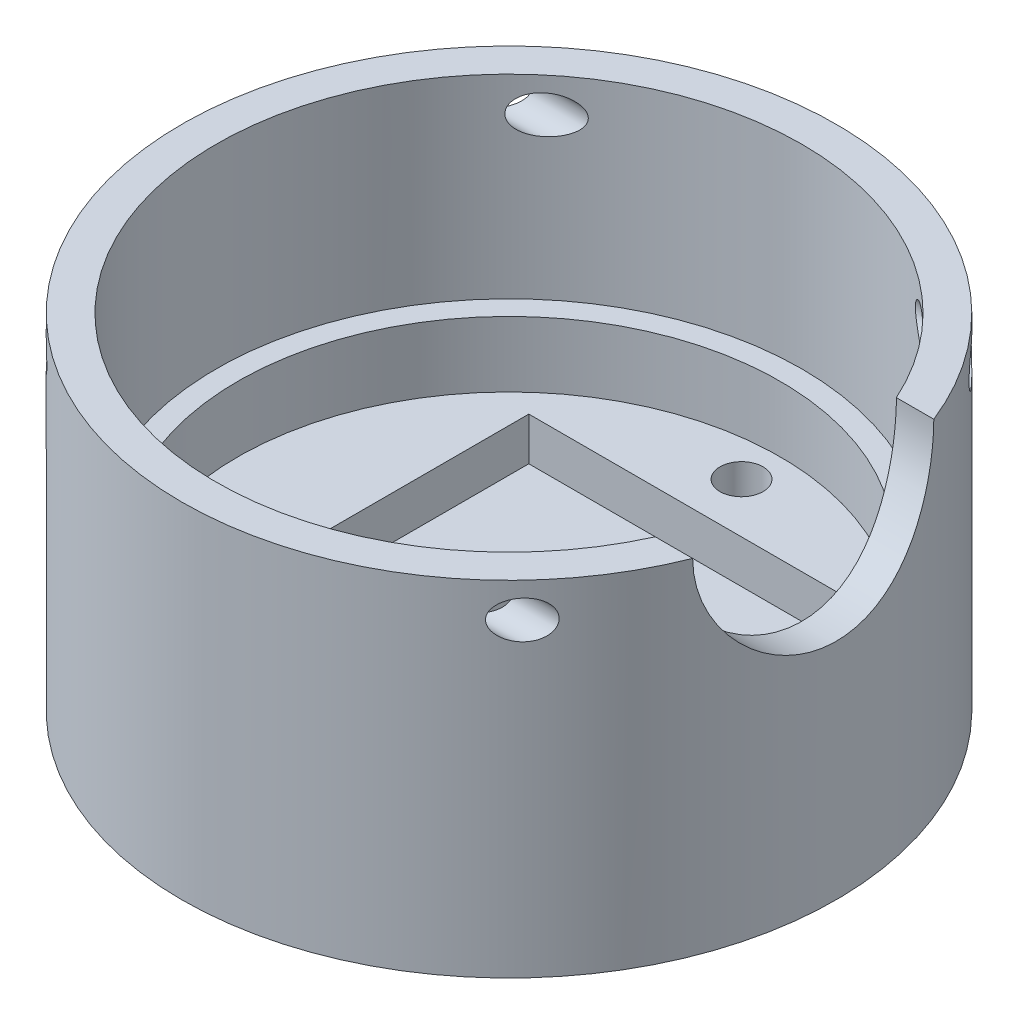
from build123d import *

# Parameters (mm, degrees)
SKETCH3_R                            = 19
MAIN_BODY_DEPTH                      = 20
CUT_START                            = -8.7
SKETCH5_R                            = 17
CUT_FOR_HEADERS_DEPTH                = 25.796268449
CUT_FOR_ADNS_WIRES_REACH             = 35.496
SKETCH7_R                            = 7
SKETCH8_R                            = 15.75
CUT_FOR_PCB_DEPTH                    = 3.8
SKETCH9_R                            = 1.25
CUT_FOR_SCREW_HOLES_DEPTH            = 5
SKETCH10_W                           = 18.9
SKETCH10_H                           = 21.2
CUT_FOR_LENS_DEPTH                   = 2.5
CUT_FOR_PUPIL_REACH                  = 34.121
SKETCH11_W                           = 8.2
SKETCH11_H                           = 10.2
CUTS_FOR_BODY_SCREW_HOLES_DEPTH      = 34.496268622
CUTS_FOR_BODY_SCREW_HOLES_DEPTH_BACK = 34.496268622
SKETCH13_R                           = 1.1


with BuildPart() as part:
    # Sketch3 → Main Body (new body)
    with BuildSketch(Plane(origin=(0, 0, 0), x_dir=(1, 0, 0), z_dir=(0, 1, 0))):
        Circle(SKETCH3_R)
    extrude(amount=-MAIN_BODY_DEPTH)

    # Sketch5 → Cut for Headers (cut, through all)
    with BuildSketch(Plane.XZ.offset(20).offset(CUT_START)):
        Circle(SKETCH5_R)
    extrude(amount=-CUT_FOR_HEADERS_DEPTH, mode=Mode.SUBTRACT)

    # Sketch7 → Cut for ADNS Wires (cut, up to next)
    with BuildSketch(Plane(origin=(0, 0, 0), x_dir=(0, 0, -1), z_dir=(1, 0, 0)), mode=Mode.PRIVATE) as cut_for_adns_wires_sk1:
        Circle(SKETCH7_R)
    cut_for_adns_wires_tool1 = extrude(cut_for_adns_wires_sk1.sketch, amount=CUT_FOR_ADNS_WIRES_REACH, mode=Mode.PRIVATE) & part.part
    add(cut_for_adns_wires_tool1.solids().sort_by_distance((0, 0, 0))[0], mode=Mode.SUBTRACT)

    # Sketch8 → Cut for PCB (cut)
    with BuildSketch(Plane(origin=(0, -11.3, 0), x_dir=(1, 0, 0), z_dir=(0, 1, 0))):
        Circle(SKETCH8_R)
    extrude(amount=-CUT_FOR_PCB_DEPTH, mode=Mode.SUBTRACT)

    # Sketch9 → Cut for Screw Holes (cut)
    with BuildSketch(Plane(origin=(0, -15.1, 0), x_dir=(1, 0, 0), z_dir=(0, 1, 0))):
        with Locations((0, 13.5)):
            Circle(SKETCH9_R)
        with Locations((0, -13.5)):
            Circle(SKETCH9_R)
    extrude(amount=-CUT_FOR_SCREW_HOLES_DEPTH, mode=Mode.SUBTRACT)

    # Sketch10 → Cut for Lens (cut)
    with BuildSketch(Plane(origin=(0, -15.1, 0), x_dir=(1, 0, 0), z_dir=(0, 1, 0))):
        Rectangle(SKETCH10_W, SKETCH10_H)
    extrude(amount=-CUT_FOR_LENS_DEPTH, mode=Mode.SUBTRACT)

    # Sketch11 → Cut for Pupil (cut, up to next)
    with BuildSketch(Plane(origin=(0, -17.6, 0), x_dir=(1, 0, 0), z_dir=(0, 1, 0)), mode=Mode.PRIVATE) as cut_for_pupil_sk1:
        Rectangle(SKETCH11_W, SKETCH11_H)
    cut_for_pupil_tool1 = extrude(cut_for_pupil_sk1.sketch, amount=-CUT_FOR_PUPIL_REACH, mode=Mode.PRIVATE) & part.part
    add(cut_for_pupil_tool1.solids().sort_by_distance((0, -17.6, 0))[0], mode=Mode.SUBTRACT)

    # Sketch13 → Cuts for Body Screw Holes (cut, two sides: drawn at the far end of the back side and taken through both)
    with BuildSketch(Plane(origin=(0, 0, 0), x_dir=(0, 0, -1), z_dir=(1, 0, 0)).offset(-CUTS_FOR_BODY_SCREW_HOLES_DEPTH_BACK)):
        with Locations((13, -2)):
            Circle(SKETCH13_R)
        with Locations((-13, -2)):
            Circle(SKETCH13_R)
    extrude(amount=CUTS_FOR_BODY_SCREW_HOLES_DEPTH + CUTS_FOR_BODY_SCREW_HOLES_DEPTH_BACK, mode=Mode.SUBTRACT)


solid = part.part
